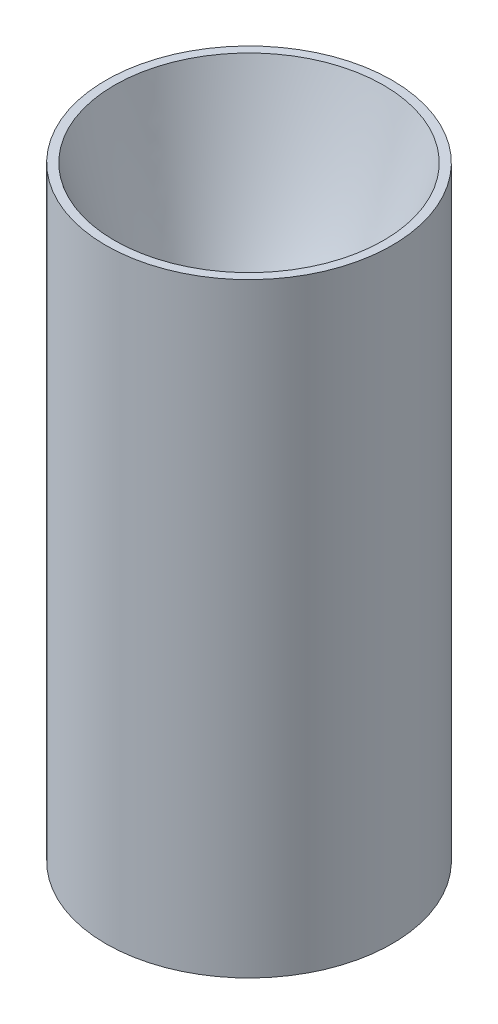
from build123d import *

# Parameters (mm, degrees)
CIRPATTERN1_COUNT              = 8
F_1_4_0_2500_DOWEL_HOLE1_D     = 6.35
F_1_4_0_2500_DOWEL_HOLE1_DEPTH = 9.906
F_1_4_0_2500_DOWEL_HOLE1_TIP   = 1.907732465


with BuildPart() as part:
    # Sketch1 → Revolve2 (revolve)
    with BuildSketch(Plane.XY):
        with BuildLine():
            Line((71.638455479, 109.927347077), (76.2, 109.927347077))
            Line((76.2, 109.927347077), (76.2, -212.127673768))
            Line((76.2, -212.127673768), (53.792460092, -212.127673768))
            Line((53.792460092, -212.127673768), (53.792460092, -59.727673768))
            add(Edge.make_bspline(
                [(53.792460092, -59.727673768), (53.79245886, -59.657143699), (53.791929716, -59.515566645), (53.789553862, -59.181725159), (53.783229261, -58.904956035), (53.77374377, -58.53272803), (53.761100869, -58.212998164), (53.741350037, -57.781754985), (53.711337691, -57.281120442), (53.667125522, -56.688158709), (53.588220844, -55.84864091), (53.488359245, -55.008326406), (53.367608162, -54.172595977), (53.197743188, -53.172585788), (53.002996543, -52.177603371), (52.777307466, -51.188699636), (52.52094656, -50.207649593), (52.240221667, -49.233238298), (51.935281056, -48.266129784), (51.544470137, -47.149295632), (51.050452654, -45.890568975), (50.509666033, -44.651129378), (49.922993197, -43.432862107), (49.291052487, -42.237253826), (48.615057474, -41.066315473), (47.895407754, -39.921133258), (47.134034361, -38.804236847), (46.430801274, -37.8516124), (45.804470143, -37.055832744), (45.263749879, -36.403541909), (44.826059142, -35.894408264), (44.425708379, -35.447153292), (44.092389689, -35.084791824), (43.784856807, -34.760500793), (43.585004587, -34.551710094), (43.355324251, -34.318676934), (43.254715329, -34.217322702), (43.20484318, -34.167450315)],
                knots=[0.082637729, 0.082637729, 0.082637729, 0.082637729, 0.082637729, 0.092574926, 0.102512123, 0.11244932, 0.122386517, 0.132323714, 0.142260911, 0.162135305, 0.182009699, 0.201884093, 0.24163288, 0.261507274, 0.281381668, 0.321130456, 0.360879243, 0.380753637, 0.400628031, 0.440376819, 0.480125606, 0.519874394, 0.559623181, 0.599371969, 0.639120757, 0.678869544, 0.718618332, 0.75836712, 0.798115907, 0.817990301, 0.837864695, 0.857739089, 0.877613483, 0.88755068, 0.897487877, 0.907425074, 0.91736227, 0.91736227, 0.91736227, 0.91736227, 0.91736227], degree=4))
            Line((43.20484318, -34.167450315), (34.597214983, -25.559822119))
            add(Edge.make_bspline(
                [(24.01, 0), (24.010001231, -0.070528647), (24.010530378, -0.21358419), (24.012906064, -0.543182916), (24.019230459, -0.824160397), (24.02871558, -1.194822071), (24.041357874, -1.513435058), (24.057158098, -1.861939603), (24.076113357, -2.193706871), (24.103750972, -2.6180694), (24.14321918, -3.122033947), (24.214231841, -3.879978675), (24.334058814, -4.886450388), (24.510418182, -6.05671076), (24.761817374, -7.385166415), (25.062727457, -8.703574515), (25.41270277, -10.009637209), (25.811293133, -11.301819597), (26.257877544, -12.578099335), (26.751935478, -13.836887484), (27.29260528, -15.076197129), (27.879411547, -16.294609794), (28.511071561, -17.489938794), (29.187464561, -18.661287758), (29.90637727, -19.805743397), (30.66895417, -20.923860076), (31.370099365, -21.874411761), (31.999668297, -22.673445482), (32.535060592, -23.32042214), (32.983187945, -23.840005018), (33.419382204, -24.329816248), (33.8467583, -24.788484391), (34.156490819, -25.113868312), (34.447792137, -25.409649048), (34.547344605, -25.509949934), (34.597214983, -25.559822119)],
                knots=[0.082637729, 0.082637729, 0.082637729, 0.082637729, 0.082637729, 0.092574926, 0.102512123, 0.11244932, 0.122386517, 0.132323714, 0.142260911, 0.152198108, 0.162135305, 0.182009699, 0.201884093, 0.24163288, 0.281381668, 0.321130456, 0.360879243, 0.400628031, 0.440376819, 0.480125606, 0.519874394, 0.559623181, 0.599371969, 0.639120757, 0.678869544, 0.718618332, 0.75836712, 0.798115907, 0.817990301, 0.837864695, 0.857739089, 0.877613483, 0.897487877, 0.907425074, 0.91736227, 0.91736227, 0.91736227, 0.91736227, 0.91736227], degree=4))
            add(Edge.make_bspline(
                [(24.01, 0), (24.010000626, 0.035892652), (24.010538457, 0.11011369), (24.012955849, 0.267641069), (24.019393694, 0.427064117), (24.031465725, 0.646764266), (24.052367213, 0.901433328), (24.086116845, 1.202537273), (24.137431431, 1.542050498), (24.201475827, 1.880996777), (24.278073727, 2.21635442), (24.367255697, 2.549239421), (24.468673539, 2.878092645), (24.582551197, 3.203347041), (24.708128897, 3.523627157), (24.846218103, 3.839666733), (24.995002427, 4.149282184), (25.156944348, 4.454783123), (25.327420631, 4.751301575), (25.513446847, 5.045703861), (25.702720396, 5.325518936), (25.9153376, 5.610727543), (26.0898085, 5.832913647), (26.277277882, 6.049951637), (26.415487374, 6.208641646), (26.581374196, 6.382121779), (26.655452387, 6.458478841), (26.706211329, 6.50923965)],
                knots=[0.082568816, 0.082568816, 0.082568816, 0.082568816, 0.082568816, 0.102426634, 0.122284453, 0.142142271, 0.162000089, 0.201715725, 0.241431362, 0.281146998, 0.320862634, 0.360578271, 0.400293907, 0.440009544, 0.47972518, 0.519440816, 0.559156453, 0.598872089, 0.638587725, 0.678303362, 0.718018998, 0.757734635, 0.797450271, 0.837165907, 0.857023726, 0.876881544, 0.91659718, 0.91659718, 0.91659718, 0.91659718, 0.91659718], degree=4))
            add(Edge.make_bspline(
                [(26.706211329, 6.50923965), (49.172333461, 34.635954224), (71.638455479, 109.927347077)],
                knots=[0, 0, 0, 1, 1, 1], degree=2))
        make_face()
    revolve(axis=Axis((0, 0, 0), (0, -1, 0)))

    # Sketch4 → 3/8-24 Tapped Hole1 (revolve, cut)
    with BuildSketch(Plane(origin=(65.2, -212.127673768, 0), x_dir=(0, 0, -1), z_dir=(1, 0, 0))):
        Polygon((0, 0), (0, 27.533468714), (4.2164, 25), (4.2164, 0), align=None)
    f_3_8_24_tapped_hole1 = revolve(axis=Axis((65.2, -218.477673768, 0), (0, 1, 0)), mode=Mode.SUBTRACT)

    # CirPattern1: 3/8-24 Tapped Hole1 ×8 about axis
    cirpattern1_axis = Axis((0, -212.127673768, 0), (0, 1, 0))
    for i in range(1, CIRPATTERN1_COUNT):
        add(f_3_8_24_tapped_hole1.rotate(cirpattern1_axis, i * 360 / CIRPATTERN1_COUNT), mode=Mode.SUBTRACT)

    # 1/4 (0.2500) Dowel Hole1
    with Locations(Plane(origin=(0, -212.127673768, 0), x_dir=(-1, 0, 0), z_dir=(0, -1, 0))):
        with Locations((-60.23694552, 24.95095979), (60.23694552, -24.95095979)):
            Hole(F_1_4_0_2500_DOWEL_HOLE1_D / 2, depth=F_1_4_0_2500_DOWEL_HOLE1_DEPTH)
            with Locations((0, 0, -(F_1_4_0_2500_DOWEL_HOLE1_DEPTH + F_1_4_0_2500_DOWEL_HOLE1_TIP / 2))):  # 118° drill point
                Cone(0, F_1_4_0_2500_DOWEL_HOLE1_D / 2, F_1_4_0_2500_DOWEL_HOLE1_TIP, mode=Mode.SUBTRACT)


solid = part.part
